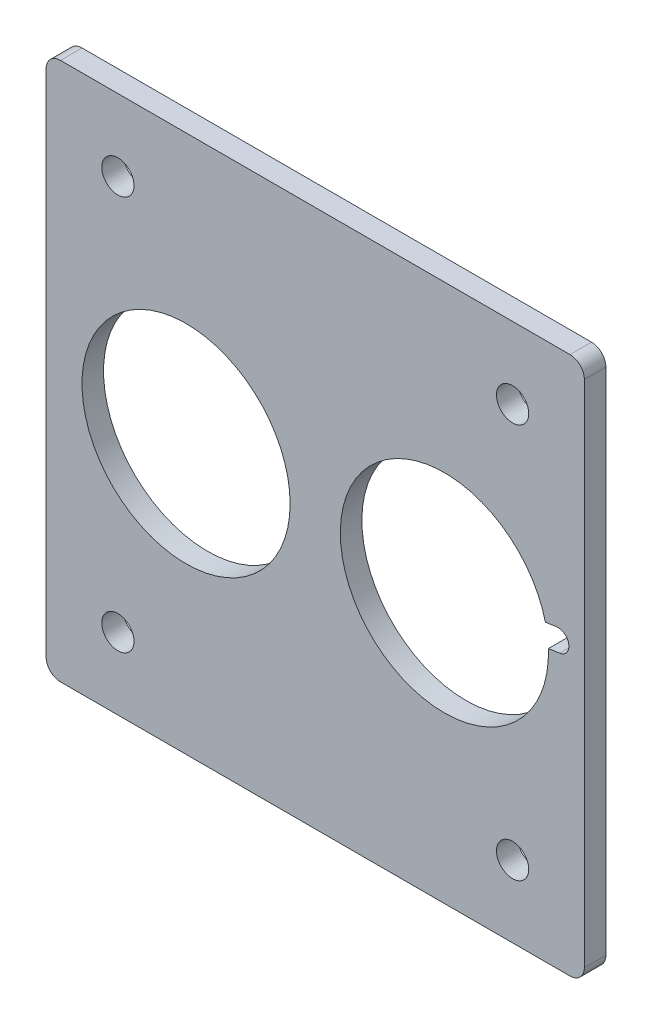
from build123d import *

# Parameters (mm, degrees)
SKIZZE1_W                       = 75
SKIZZE1_H                       = 75
AUFSATZ_LINEAR_AUSTRAGEN1_DEPTH = 3
SKIZZE2_R                       = 14.5
SCHNITT_LINEAR_AUSTRAGEN1_DEPTH = 54.117793629
VERRUNDUNG1_R                   = 2
DURCHGANGSLOCH_F_R_M41_D        = 4.5
SCHNITT_LINEAR_AUSTRAGEN2_DEPTH = 54.117793629


with BuildPart() as part:
    # Skizze1 → Aufsatz-Linear austragen1 (new body)
    with BuildSketch(Plane.XY):
        Rectangle(SKIZZE1_W, SKIZZE1_H)
    extrude(amount=AUFSATZ_LINEAR_AUSTRAGEN1_DEPTH)

    # Skizze2 → Schnitt-Linear austragen1 (cut, through all)
    with BuildSketch(Plane.XY.offset(3)):
        with Locations((-18, 0)):
            Circle(SKIZZE2_R)
        with Locations((18, 0)):
            Circle(SKIZZE2_R)
    extrude(amount=-SCHNITT_LINEAR_AUSTRAGEN1_DEPTH, mode=Mode.SUBTRACT)

    # Verrundung1
    verrundung1_edges = [part.edges().sort_by_distance(p)[0] for p in [
        (-37.5, -37.5, 1.5),
        (-37.5, 37.5, 1.5),
        (37.5, -37.5, 1.5),
        (37.5, 37.5, 1.5),
    ]]
    fillet(verrundung1_edges, radius=VERRUNDUNG1_R)

    # Durchgangsloch für M41 (through all)
    with Locations(Plane.XY.offset(3)):
        with Locations((27.5, 27.5), (-27.5, 27.5)):
            durchgangsloch_f_r_m41 = Hole(DURCHGANGSLOCH_F_R_M41_D / 2)

    # Spiegeln1: Durchgangsloch für M41 across plane
    add(durchgangsloch_f_r_m41.mirror(Plane.ZX), mode=Mode.SUBTRACT)

    # Skizze6 → Schnitt-Linear austragen2 (cut, through all)
    with BuildSketch(Plane.XY.offset(3)):
        with BuildLine():
            Line((17.791240349, 1.485402103), (33.635529448, 3.712171718))
            ThreePointArc((33.635529448, 3.712171718), (35.329691203, 2.435529267), (34.053048751, 0.741367512))
            Line((34.053048751, 0.741367512), (18.208759651, -1.485402103))
            ThreePointArc((18.208759651, -1.485402103), (16.514597897, -0.208759651), (17.791240349, 1.485402103))
        make_face()
    extrude(amount=-SCHNITT_LINEAR_AUSTRAGEN2_DEPTH, mode=Mode.SUBTRACT)


solid = part.part
